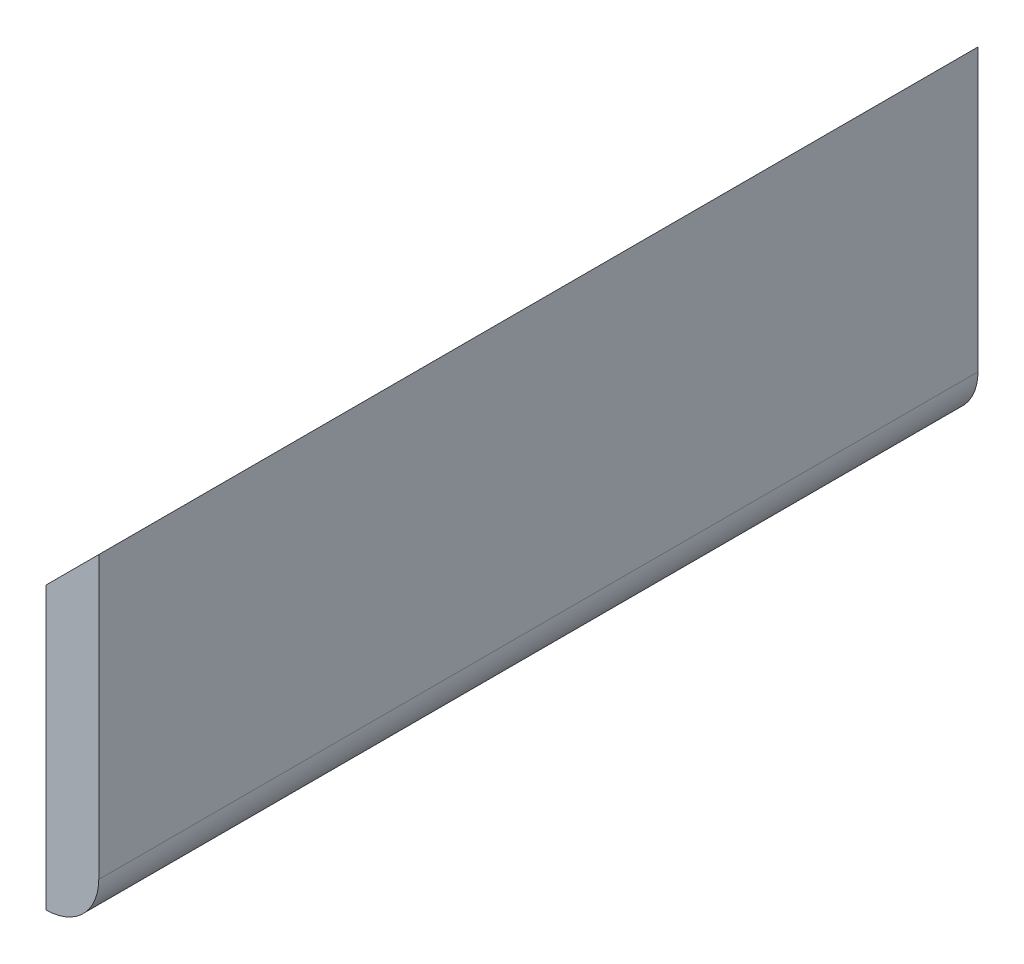
from build123d import *

# Parameters (mm, degrees)
SKETCH2_R                = 2.25
BOSS_EXTRUDE2_DEPTH      = 5
BOSS_EXTRUDE3_DEPTH      = 85
SKETCH2_2_R              = 2.25
CUT_EXTRUDE1_DEPTH       = 5
SKETCH9_W                = 20
SKETCH9_H                = 85
BOSS_EXTRUDE6_DEPTH      = 21.72
BOSS_EXTRUDE7_DEPTH      = 75
BOSS_EXTRUDE7_DEPTH_BACK = 20
FILLET2_R                = 15
SKETCH12_W               = 40
SKETCH12_H               = 246
CUT_EXTRUDE2_DEPTH       = 75
CHAMFER2_SIZE            = 15


with BuildPart() as part:
    # Sketch2 → Boss-Extrude2 (new body)
    with BuildSketch(Plane(origin=(0, 0, 0), x_dir=(0, 1, 0), z_dir=(0, 0, 1))):
        with BuildLine():
            Line((3.872983346, 1), (16, 1))
            Line((16, 1), (16, -1))
            Line((16, -1), (3.872983346, -1))
            ThreePointArc((3.872983346, -1), (-4, 0), (3.872983346, 1))
        make_face()
        with Locations(Location((0, 0, 0), (0, 0, 270))):
            Circle(SKETCH2_R, mode=Mode.SUBTRACT)
    extrude(amount=BOSS_EXTRUDE2_DEPTH)

    # Sketch4 → Boss-Extrude3 (add)
    with BuildSketch(Plane(origin=(0, 0, 0), x_dir=(1, 0, 0), z_dir=(0, 0, -1))):
        with BuildLine():
            Line((-2.5, 5.5), (2.5, 5.5))
            ThreePointArc((2.5, 5.5), (6.035533906, 4.035533906), (7.5, 0.5))
            Line((7.5, 0.5), (7.5, -19.5))
            Line((7.5, -19.5), (-7.5, -19.5))
            Line((-7.5, -19.5), (-7.5, 0.5))
            ThreePointArc((-7.5, 0.5), (-6.035533906, 4.035533906), (-2.5, 5.5))
        make_face()
    extrude(amount=-BOSS_EXTRUDE3_DEPTH)

    # Sketch2<2> → Cut-Extrude1 (cut)
    with BuildSketch(Plane(origin=(0, 0, 0), x_dir=(0, 1, 0), z_dir=(0, 0, 1))):
        with BuildLine():
            Line((3.872983346, 1), (16, 1))
            Line((16, 1), (16, -1))
            Line((16, -1), (3.872983346, -1))
            ThreePointArc((3.872983346, -1), (-4, 0), (3.872983346, 1))
        make_face()
        with Locations(Location((0, 0, 0), (0, 0, 270))):
            Circle(SKETCH2_2_R, mode=Mode.SUBTRACT)
    cut_extrude1 = extrude(amount=CUT_EXTRUDE1_DEPTH, mode=Mode.SUBTRACT)

    # Mirror1: Cut-Extrude1 across plane
    add(cut_extrude1.mirror(Plane.XY.offset(42.5)), mode=Mode.SUBTRACT)

    # Sketch9 → Boss-Extrude6 (add)
    with BuildSketch(Plane.YZ.offset(7.5)):
        with Locations((9.5, 42.5)):
            Rectangle(SKETCH9_W, SKETCH9_H)
    extrude(amount=BOSS_EXTRUDE6_DEPTH)

    # Sketch11 → Boss-Extrude7 (add, two sides: drawn at the far end of the back side and taken through both)
    with BuildSketch(Plane(origin=(0, 19.5, 0), x_dir=(-1, 0, 0), z_dir=(0, 1, 0)).offset(-BOSS_EXTRUDE7_DEPTH_BACK)):
        Polygon((-27.22, 0), (-14.22, 0), (-14.22, -82.5), (-29.22, -82.5), (-29.22, 167.5), (-14.22, 167.5), (-14.22, 85), (-27.22, 85), align=None)
    extrude(amount=BOSS_EXTRUDE7_DEPTH + BOSS_EXTRUDE7_DEPTH_BACK)

    # Fillet2
    fillet2_edges = [part.edges().sort_by_distance(p)[0] for p in [
        (29.22, -0.5, 42.5),
    ]]
    fillet(fillet2_edges, radius=FILLET2_R)

    # Sketch12 → Cut-Extrude2 (cut)
    with BuildSketch(Plane(origin=(0, 94.5, 0), x_dir=(-1, 0, 0), z_dir=(0, 1, 0))):
        with Locations((-7.22, 42.5)):
            Rectangle(SKETCH12_W, SKETCH12_H)
    extrude(amount=-CUT_EXTRUDE2_DEPTH, mode=Mode.SUBTRACT)

    # Chamfer2
    chamfer2_edges = [part.edges().sort_by_distance(p)[0] for p in [
        (14.22, 94.5, 166.5),
    ]]
    chamfer(chamfer2_edges, length=CHAMFER2_SIZE - 0.0001)  # a hair under: the kernel refuses the full size


solid = part.part
